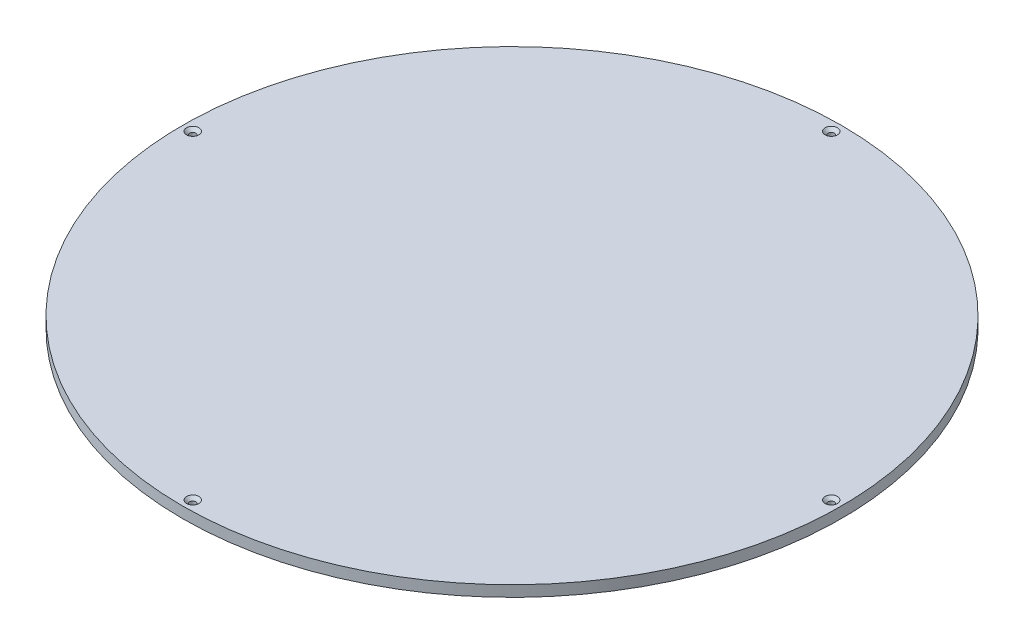
from build123d import *

# Parameters (mm, degrees)
SKETCH1_R           = 160
SKETCH1_R_2         = 1.5
BOSS_EXTRUDE1_DEPTH = 5.333
CHAMFER1_SIZE       = 1.5


with BuildPart() as part:
    # Sketch1 → Boss-Extrude1 (new body)
    with BuildSketch(Plane(origin=(0, 0, 0), x_dir=(1, 0, 0), z_dir=(0, 1, 0))):
        Circle(SKETCH1_R)
        with Locations((155, 0)):
            Circle(SKETCH1_R_2, mode=Mode.SUBTRACT)
        with Locations((0, -155)):
            Circle(SKETCH1_R_2, mode=Mode.SUBTRACT)
        with Locations((-155, 0)):
            Circle(SKETCH1_R_2, mode=Mode.SUBTRACT)
        with Locations((0, 155)):
            Circle(SKETCH1_R_2, mode=Mode.SUBTRACT)
    extrude(amount=-BOSS_EXTRUDE1_DEPTH)

    # Chamfer1
    chamfer1_edges = [part.edges().sort_by_distance(p)[0] for p in [
        (153.5, 0, 0),
        (-156.5, 0, 0),
        (-1.5, 0, -155),
        (-1.5, 0, 155),
    ]]
    chamfer(chamfer1_edges, length=CHAMFER1_SIZE)


solid = part.part
